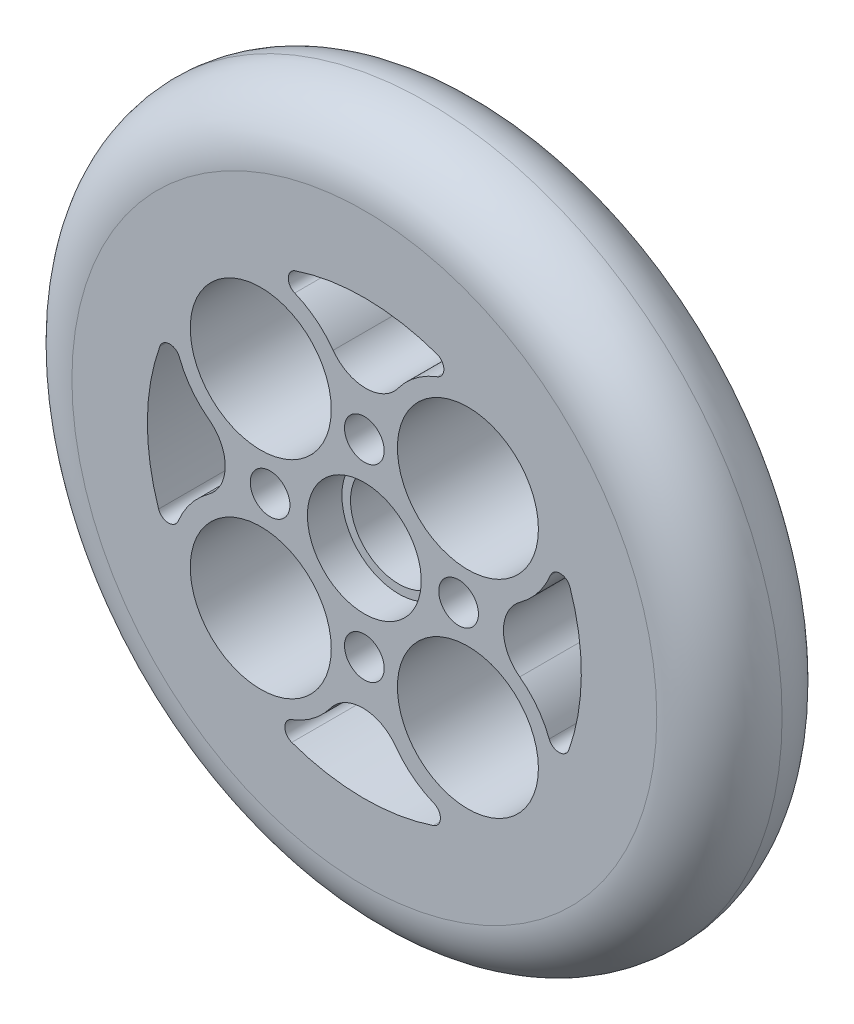
from build123d import *

# Parameters (mm, degrees)
EXTRUDE_2_DEPTH      = 12
EXTRUDE_2_DEPTH_BACK = 12
SKETCH_1_R           = 68
FILLET_1_R           = 12
SKETCH_2_R           = 9.25
CUT_EXTRUDE_1_DEPTH  = 100.116093684
SKETCH_3_R           = 10.9
CUT_EXTRUDE_2_DEPTH  = 6.6
SKETCH_4_R           = 3.8
SKETCH_4_R_2         = 13.5
CUT_EXTRUDE_3_DEPTH  = 100.116093684
SKETCH_5_R           = 13.5
SKETCH_5_R_2         = 3.8
CUT_EXTRUDE_4_DEPTH  = 100.116093684


with BuildPart() as part:
    # 草图1 → 凸台-拉伸2 (new, two sides: drawn at the far end of the back side and taken through both)
    with BuildSketch(Plane.XY.offset(-EXTRUDE_2_DEPTH_BACK)):
        Circle(SKETCH_1_R)
    extrude(amount=EXTRUDE_2_DEPTH + EXTRUDE_2_DEPTH_BACK)

    # 圆角1
    fillet_1_edges = [part.edges().sort_by_distance(p)[0] for p in [
        (-68, 0, -12),
        (-68, 0, 12),
    ]]
    fillet(fillet_1_edges, radius=FILLET_1_R - 0.0001)  # a hair under: the kernel refuses the full size

    # 草图2 → 切除-拉伸1 (cut, through all)
    with BuildSketch(Plane(origin=(0, 0, -12), x_dir=(-1, 0, 0), z_dir=(0, 0, -1))):
        Circle(SKETCH_2_R)
    extrude(amount=-CUT_EXTRUDE_1_DEPTH, mode=Mode.SUBTRACT)

    # 草图3 → 切除-拉伸2 (cut)
    with BuildSketch(Plane(origin=(0, 0, -12), x_dir=(-1, 0, 0), z_dir=(0, 0, -1))):
        Circle(SKETCH_3_R)
    cut_extrude_2 = extrude(amount=-CUT_EXTRUDE_2_DEPTH, mode=Mode.SUBTRACT)

    # 镜向1: 切除-拉伸2 across plane
    add(cut_extrude_2.mirror(Plane.XY), mode=Mode.SUBTRACT)

    # 草图4 → 切除-拉伸3 (cut, through all)
    with BuildSketch(Plane.XY.offset(12)):
        with Locations((-18.05, 0)):
            Circle(SKETCH_4_R)
        with Locations((0, 18.05)):
            Circle(SKETCH_4_R)
        with Locations((18.05, 0)):
            Circle(SKETCH_4_R)
        with Locations((0, -18.05)):
            Circle(SKETCH_4_R)
        with Locations((-19.834345212, 19.834345212)):
            Circle(SKETCH_4_R_2)
        with Locations((19.834345212, 19.834345212)):
            Circle(SKETCH_4_R_2)
        with Locations((19.834345212, -19.834345212)):
            Circle(SKETCH_4_R_2)
        with Locations((-19.834345212, -19.834345212)):
            Circle(SKETCH_4_R_2)
    extrude(amount=-CUT_EXTRUDE_3_DEPTH, mode=Mode.SUBTRACT)

    # 草图5 → 切除-拉伸4 (cut, through all)
    with BuildSketch(Plane.XY.offset(12)):
        with Locations((-19.834345212, 19.834345212)):
            Circle(SKETCH_5_R)
        with Locations((-19.834345212, -19.834345212)):
            Circle(SKETCH_5_R)
        with Locations((-18.05, 0)):
            Circle(SKETCH_5_R_2)
        with BuildLine():
            ThreePointArc((-39.156189478, 13.899472133), (-41.548381428, 0.366743421), (-39.395447702, -13.206104662))
            ThreePointArc((-39.395447702, -13.206104662), (-37.565828535, -14.569320158), (-35.649438128, -13.331050964))
            ThreePointArc((-35.649438128, -13.331050964), (-33.259357653, -9.242884455), (-29.839682343, -5.967001238))
            ThreePointArc((-29.839682343, -5.967001238), (-26.643088536, 0.229347635), (-29.755578801, 6.468366442))
            ThreePointArc((-29.755578801, 6.468366442), (-33.114429859, 9.798428902), (-35.401059543, 13.938781679))
            ThreePointArc((-35.401059543, 13.938781679), (-37.292350318, 15.230314561), (-39.156189478, 13.899472133))
        make_face()
        with BuildLine():
            ThreePointArc((6.468366442, 29.755578801), (0.229347635, 26.643088536), (-5.967001238, 29.839682343))
            ThreePointArc((-5.967001238, 29.839682343), (-9.242884455, 33.259357653), (-13.331050964, 35.649438128))
            ThreePointArc((-13.331050964, 35.649438128), (-14.569320158, 37.565828535), (-13.206104662, 39.395447702))
            ThreePointArc((-13.206104662, 39.395447702), (0.366743421, 41.548381428), (13.899472133, 39.156189478))
            ThreePointArc((13.899472133, 39.156189478), (15.230314561, 37.292350318), (13.938781679, 35.401059543))
            ThreePointArc((13.938781679, 35.401059543), (9.798428902, 33.114429859), (6.468366442, 29.755578801))
        make_face()
        with BuildLine():
            ThreePointArc((29.755578801, -6.468366442), (26.643088536, -0.229347635), (29.839682343, 5.967001238))
            ThreePointArc((29.839682343, 5.967001238), (33.259357653, 9.242884455), (35.649438128, 13.331050964))
            ThreePointArc((35.649438128, 13.331050964), (37.565828535, 14.569320158), (39.395447702, 13.206104662))
            ThreePointArc((39.395447702, 13.206104662), (41.548381428, -0.366743421), (39.156189478, -13.899472133))
            ThreePointArc((39.156189478, -13.899472133), (37.292350318, -15.230314561), (35.401059543, -13.938781679))
            ThreePointArc((35.401059543, -13.938781679), (33.114429859, -9.798428902), (29.755578801, -6.468366442))
        make_face()
        with BuildLine():
            ThreePointArc((-6.468366442, -29.755578801), (-0.229347635, -26.643088536), (5.967001238, -29.839682343))
            ThreePointArc((5.967001238, -29.839682343), (9.242884455, -33.259357653), (13.331050964, -35.649438128))
            ThreePointArc((13.331050964, -35.649438128), (14.569320158, -37.565828535), (13.206104662, -39.395447702))
            ThreePointArc((13.206104662, -39.395447702), (-0.366743421, -41.548381428), (-13.899472133, -39.156189478))
            ThreePointArc((-13.899472133, -39.156189478), (-15.230314561, -37.292350318), (-13.938781679, -35.401059543))
            ThreePointArc((-13.938781679, -35.401059543), (-9.798428902, -33.114429859), (-6.468366442, -29.755578801))
        make_face()
    extrude(amount=-CUT_EXTRUDE_4_DEPTH, mode=Mode.SUBTRACT)


solid = part.part
